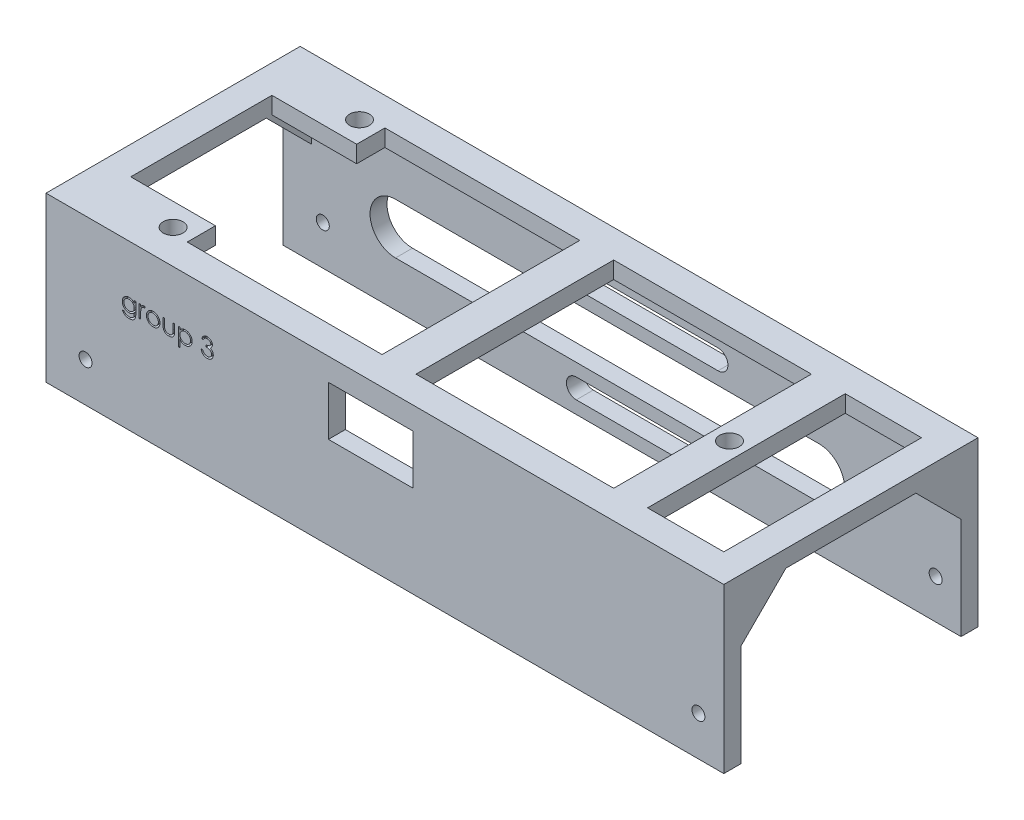
from build123d import *

# Parameters (mm, degrees)
SKETCH1_W           = 120
SKETCH1_H           = 29
BOSS_EXTRUDE5_DEPTH = 45
SHELL9_T            = -3
SKETCH3_R           = 1.15
CUT_EXTRUDE2_DEPTH  = 79
CUT_EXTRUDE8_DEPTH  = 23
SKETCH7_W           = 15
SKETCH7_H           = 8.75
CUT_EXTRUDE9_DEPTH  = 20
SKETCH13_W          = 110
SKETCH13_H          = 35
CUT_EXTRUDE14_DEPTH = 10
SKETCH17_W          = 15
SKETCH17_H          = 5
SKETCH17_W_2        = 6
SKETCH17_H_2        = 35
BOSS_EXTRUDE6_DEPTH = 3
SKETCH17_4_R        = 1.75
CUT_EXTRUDE16_DEPTH = 10
CUT_EXTRUDE15_DEPTH = 1.5
BOSS_EXTRUDE7_DEPTH = 5
BOSS_EXTRUDE8_DEPTH = 5


with BuildPart() as part:
    # Sketch1 → Boss-Extrude5 (new body)
    with BuildSketch(Plane.XY):
        with Locations((60, 14.5)):
            Rectangle(SKETCH1_W, SKETCH1_H)
    extrude(amount=BOSS_EXTRUDE5_DEPTH)

    # Shell9
    shell9_openings = [part.faces().sort_by_distance(p)[0] for p in [
        (120, 14.5, 22.5),
        (60, 0, 22.5),
        (0, 14.5, 22.5),
    ]]
    offset(amount=SHELL9_T, openings=shell9_openings, kind=Kind.INTERSECTION)

    # Sketch3 → Cut-Extrude2 (cut)
    with BuildSketch(Plane(origin=(0, 0, 0), x_dir=(-1, 0, 0), z_dir=(0, 0, -1))):
        with Locations((-7, 7)):
            Circle(SKETCH3_R)
        with Locations((-115.5, 7)):
            Circle(SKETCH3_R)
    extrude(amount=-CUT_EXTRUDE2_DEPTH, mode=Mode.SUBTRACT)

    # Sketch6 → Cut-Extrude8 (cut)
    with BuildSketch(Plane(origin=(0, 0, 0), x_dir=(-1, 0, 0), z_dir=(0, 0, -1))):
        with BuildLine():
            Line((-51.883496676, 22.75), (-76.973496676, 22.75))
            ThreePointArc((-76.973496676, 22.75), (-78.723496676, 21), (-76.973496676, 19.25))
            Line((-76.973496676, 19.25), (-51.883496676, 19.25))
            ThreePointArc((-51.883496676, 19.25), (-50.133496676, 21), (-51.883496676, 22.75))
        make_face()
        with BuildLine():
            Line((-19.873496676, 17), (-94.873496676, 17))
            ThreePointArc((-94.873496676, 17), (-99.373496676, 12.5), (-94.873496676, 8))
            Line((-94.873496676, 8), (-19.873496676, 8))
            ThreePointArc((-19.873496676, 8), (-15.373496676, 12.5), (-19.873496676, 17))
        make_face()
        with BuildLine():
            ThreePointArc((-76.973496676, 5.75), (-78.723496676, 4), (-76.973496676, 2.25))
            Line((-76.973496676, 2.25), (-51.883496676, 2.25))
            ThreePointArc((-51.883496676, 2.25), (-50.133496676, 4), (-51.883496676, 5.75))
            Line((-51.883496676, 5.75), (-76.973496676, 5.75))
        make_face()
    extrude(amount=-CUT_EXTRUDE8_DEPTH, mode=Mode.SUBTRACT)

    # Sketch7 → Cut-Extrude9 (cut)
    with BuildSketch(Plane.XY.offset(45)):
        with Locations((57.5, 20.625)):
            Rectangle(SKETCH7_W, SKETCH7_H)
    extrude(amount=-CUT_EXTRUDE9_DEPTH, mode=Mode.SUBTRACT)

    # Sketch13 → Cut-Extrude14 (cut)
    with BuildSketch(Plane(origin=(0, 29, 0), x_dir=(1, 0, 0), z_dir=(0, 1, 0))):
        with Locations((60, -22.5)):
            Rectangle(SKETCH13_W, SKETCH13_H)
    extrude(amount=-CUT_EXTRUDE14_DEPTH, mode=Mode.SUBTRACT)

    # Sketch17 → Boss-Extrude6 (add)
    with BuildSketch(Plane(origin=(0, 29, 0), x_dir=(1, 0, 0), z_dir=(0, 1, 0))):
        with Locations((12.5, -7.5)):
            Rectangle(SKETCH17_W, SKETCH17_H)
        with Locations((12.5, -37.5)):
            Rectangle(SKETCH17_W, SKETCH17_H)
        with Locations((57.5, -22.5)):
            Rectangle(SKETCH17_W_2, SKETCH17_H_2)
        with Locations((98.5, -22.5)):
            Rectangle(SKETCH17_W_2, SKETCH17_H_2)
    extrude(amount=-BOSS_EXTRUDE6_DEPTH)

    # Sketch17<4> → Cut-Extrude16 (cut)
    with BuildSketch(Plane(origin=(0, 29, 0), x_dir=(1, 0, 0), z_dir=(0, 1, 0))):
        with Locations((98.5, -22.5)):
            Circle(SKETCH17_4_R)
        with Locations((16.5, -6)):
            Circle(SKETCH17_4_R)
        with Locations((16.5, -39)):
            Circle(SKETCH17_4_R)
    extrude(amount=-CUT_EXTRUDE16_DEPTH, mode=Mode.SUBTRACT)

    # Sketch20 → Cut-Extrude15 (cut)
    # profile 1 of 6: a face of its own
    with BuildSketch(Plane.XY.offset(45)):
        with BuildLine():
            Line((15.616704574, 20.332761713), (15.901640472, 20.332761713))
            Line((15.901640472, 20.332761713), (15.901640472, 18.49149068))
            add(Edge.make_bspline(
                [(15.901640472, 18.49149068), (15.901389155, 18.452268005), (15.900904052, 18.376558794), (15.897410671, 18.267086354), (15.890044057, 18.165970691), (15.881690467, 18.072750642), (15.869673803, 17.9878583), (15.854999527, 17.91104035), (15.838457161, 17.842223075), (15.823924535, 17.799836969), (15.817050127, 17.779786954)],
                knots=[0, 0, 0, 0, 1.307562039, 2.523909702, 3.650326591, 4.686913197, 5.643429486, 6.506965704, 7.293745905, 8, 8, 8, 8], degree=3))
            add(Edge.make_bspline(
                [(15.817050127, 17.779786954), (15.806899889, 17.753724811), (15.786902899, 17.702379766), (15.749450931, 17.629595775), (15.707510176, 17.561064407), (15.659606909, 17.497167576), (15.605957751, 17.438226048), (15.547826683, 17.382959277), (15.484081581, 17.332536497), (15.414758892, 17.287827692), (15.341456639, 17.247562292), (15.264216961, 17.212685764), (15.183475406, 17.182308413), (15.098473497, 17.159554734), (15.010543928, 17.139838237), (14.918652687, 17.127006986), (14.823336649, 17.118273869), (14.758525483, 17.117466301), (14.725643877, 17.117056585)],
                knots=[0, 0, 0, 0, 0.981931301, 1.934503488, 2.87077864, 3.801706999, 4.735015492, 5.667491629, 6.616593066, 7.585388521, 8.561939025, 9.551802639, 10.560317337, 11.588439944, 12.640189604, 13.723962949, 14.845264515, 16, 16, 16, 16], degree=3))
            add(Edge.make_bspline(
                [(14.725643877, 17.117056585), (14.677669868, 17.11783354), (14.583963739, 17.119351142), (14.447343495, 17.137032186), (14.317590571, 17.162027939), (14.196419457, 17.19986072), (14.084595869, 17.246158561), (13.982883496, 17.299312554), (13.89219542, 17.360262855), (13.810440374, 17.429659829), (13.736651931, 17.512176883), (13.667230747, 17.609421549), (13.600409749, 17.722875084), (13.561249628, 17.806144188), (13.540743036, 17.849748893)],
                knots=[0, 0, 0, 0, 1.157897085, 2.2616841, 3.32207898, 4.345638746, 5.321241055, 6.241986252, 7.112515963, 7.955008012, 8.825025602, 9.77857164, 10.836726669, 12, 12, 12, 12], degree=3))
            Line((13.540743036, 17.849748893), (13.825678933, 17.849748893))
            add(Edge.make_bspline(
                [(13.825678933, 17.849748893), (13.848595366, 17.813367134), (13.89339417, 17.742245276), (13.977167435, 17.650158342), (14.068976031, 17.571460647), (14.171918315, 17.508041587), (14.286422618, 17.460226276), (14.412557826, 17.426140115), (14.55135034, 17.405732787), (14.647977577, 17.403273256), (14.698295119, 17.401992483)],
                knots=[0, 0, 0, 0, 0.997731894, 1.950442991, 2.880492273, 3.800895997, 4.748200782, 5.754801363, 6.83083817, 8, 8, 8, 8], degree=3))
            add(Edge.make_bspline(
                [(14.698295119, 17.401992483), (14.747976513, 17.403289832), (14.843757266, 17.405790991), (14.981489827, 17.426149222), (15.107215235, 17.460233694), (15.220209131, 17.507957016), (15.319138293, 17.566422742), (15.404420599, 17.631737095), (15.473494698, 17.705379862), (15.519952175, 17.773217644), (15.548830721, 17.833655247), (15.567220536, 17.885682245), (15.582164779, 17.944513069), (15.594665061, 18.009950487), (15.604980103, 18.08208799), (15.611514147, 18.161090521), (15.616236561, 18.246778529), (15.616544963, 18.306190162), (15.616704574, 18.336938396)],
                knots=[0, 0, 0, 0, 1.570740765, 3.028230971, 4.391408896, 5.680370741, 6.894727393, 8.017376726, 9.065722033, 10.075533815, 10.603371122, 11.180248986, 11.817768598, 12.521299649, 13.286540596, 14.121245857, 15.027658897, 16, 16, 16, 16], degree=3))
            Line((15.616704574, 18.336938396), (15.616704574, 18.457145728))
            add(Edge.make_bspline(
                [(15.616704574, 18.457145728), (15.587783846, 18.422727093), (15.530451097, 18.354495237), (15.431438879, 18.265085752), (15.323292106, 18.188081905), (15.206194892, 18.124927858), (15.083015558, 18.074416852), (14.955088249, 18.039090023), (14.823559742, 18.016266399), (14.734431006, 18.013810477), (14.689390872, 18.012569406)],
                knots=[0, 0, 0, 0, 1.012485704, 2.007162095, 2.997754123, 3.998611389, 4.999708251, 5.992315798, 6.98544096, 8, 8, 8, 8], degree=3))
            add(Edge.make_bspline(
                [(14.689390872, 18.012569406), (14.662869399, 18.013036608), (14.610140308, 18.013965485), (14.531804216, 18.022092376), (14.454624104, 18.033884092), (14.378779973, 18.051193683), (14.304162381, 18.073411178), (14.230894637, 18.101184934), (14.158383509, 18.132585791), (14.087947043, 18.169572548), (14.020286767, 18.210722641), (13.955913021, 18.255298635), (13.895162989, 18.303067225), (13.838614888, 18.354499449), (13.786342893, 18.409520868), (13.737643956, 18.467544948), (13.693323362, 18.52938192), (13.652471645, 18.593904232), (13.617040867, 18.661541641), (13.585940044, 18.730827485), (13.558898655, 18.801613615), (13.537340041, 18.874137022), (13.520874388, 18.948351984), (13.508618682, 19.02413692), (13.501667308, 19.1017252), (13.500583341, 19.153995995), (13.500037908, 19.180297771)],
                knots=[0, 0, 0, 0, 1.028754217, 2.045334182, 3.052854819, 4.056607503, 5.061168794, 6.071104265, 7.095078842, 8.125279047, 9.155117945, 10.165957491, 11.161587969, 12.151493252, 13.128948131, 14.104219989, 15.088194871, 16.07871515, 17.064853787, 18.047899887, 19.02414258, 20.002704429, 20.980574569, 21.971845993, 22.979467364, 24, 24, 24, 24], degree=3))
            add(Edge.make_bspline(
                [(13.500037908, 19.180297771), (13.500508866, 19.206607723), (13.501448958, 19.259125723), (13.509568775, 19.337030594), (13.521151346, 19.413892296), (13.53948268, 19.488918582), (13.561546682, 19.562963892), (13.588873066, 19.635481306), (13.621728655, 19.706492911), (13.658930356, 19.776051293), (13.700735212, 19.843223058), (13.746575391, 19.907019373), (13.796506234, 19.966970786), (13.8498389, 20.023682111), (13.907224591, 20.07660618), (13.96863362, 20.125614541), (14.033460661, 20.171528693), (14.101906631, 20.213358264), (14.172915405, 20.250353587), (14.24468294, 20.284110729), (14.31815991, 20.310902394), (14.391976428, 20.334509063), (14.467432493, 20.351232418), (14.543602915, 20.364134024), (14.620748464, 20.371994163), (14.672412876, 20.372975315), (14.698295119, 20.373466842)],
                knots=[0, 0, 0, 0, 1.008818848, 2.013730394, 3.001654427, 3.987803273, 4.973046549, 5.963777569, 6.957074694, 7.972068341, 8.987420212, 9.989399531, 10.982630087, 11.977756091, 12.973280677, 13.973972381, 14.989194003, 16.018387222, 17.047741039, 18.059210846, 19.057554164, 20.045176975, 21.029480261, 22.018708529, 23.007435371, 24, 24, 24, 24], degree=3))
            add(Edge.make_bspline(
                [(14.698295119, 20.373466842), (14.740977042, 20.372236145), (14.825260726, 20.369805898), (14.949295278, 20.350736716), (15.068985739, 20.320334718), (15.18500751, 20.276777682), (15.298305708, 20.217314433), (15.408506924, 20.138989044), (15.515929996, 20.04109895), (15.582222028, 19.966030281), (15.616704574, 19.926982467)],
                knots=[0, 0, 0, 0, 0.96728863, 1.910097829, 2.838038873, 3.762875196, 4.71315279, 5.730631239, 6.819562287, 8, 8, 8, 8], degree=3))
            Line((15.616704574, 19.926982467), (15.616704574, 20.332761713))
        make_face()
        with BuildLine():
            add(Edge.make_bspline(
                [(14.721191754, 20.088530944), (14.679526044, 20.087114835), (14.597036773, 20.084311238), (14.476125205, 20.060376534), (14.359396844, 20.022869897), (14.249083349, 19.969219095), (14.145753328, 19.903819322), (14.054064026, 19.824589204), (13.973868138, 19.734105154), (13.90602933, 19.633185287), (13.852025876, 19.524307938), (13.813795774, 19.409544629), (13.78907611, 19.290749742), (13.78634774, 19.209676024), (13.784973805, 19.168849454)],
                knots=[0, 0, 0, 0, 1.026226791, 2.031711442, 3.026614839, 4.04107745, 5.047145931, 6.032893242, 7.017642609, 8.019221815, 9.021877557, 10.003543541, 10.994637589, 12, 12, 12, 12], degree=3))
            add(Edge.make_bspline(
                [(13.784973805, 19.168849454), (13.78563217, 19.138067128), (13.786926982, 19.077527295), (13.799376227, 18.988683633), (13.819497532, 18.904065063), (13.848015569, 18.823666466), (13.883351228, 18.747026688), (13.927794307, 18.674673668), (13.980091974, 18.60654297), (14.039834895, 18.543138509), (14.105672041, 18.485388916), (14.177081601, 18.434645122), (14.25396672, 18.393142682), (14.334436469, 18.357273494), (14.42044337, 18.331076054), (14.510748612, 18.311083733), (14.605991079, 18.299645788), (14.670916871, 18.298228108), (14.704019278, 18.297505303)],
                knots=[0, 0, 0, 0, 1.039728707, 2.044842319, 3.024901384, 3.974314358, 4.923051295, 5.871625912, 6.837440708, 7.820715446, 8.810779094, 9.792721783, 10.773906224, 11.758876063, 12.764959493, 13.806266761, 14.881525401, 16, 16, 16, 16], degree=3))
            add(Edge.make_bspline(
                [(14.704019278, 18.297505303), (14.737550687, 18.298201634), (14.803121003, 18.299563302), (14.898888923, 18.311268619), (14.989632909, 18.330157126), (15.075269755, 18.356975013), (15.1561228, 18.39119403), (15.231283772, 18.434497961), (15.302364264, 18.483814268), (15.367094722, 18.541338023), (15.425627358, 18.604733697), (15.476636696, 18.673717281), (15.520101946, 18.747250752), (15.556095261, 18.825325821), (15.583573711, 18.908549241), (15.60200586, 18.996712964), (15.614893407, 19.089394606), (15.616091675, 19.152902422), (15.616704574, 19.185385912)],
                knots=[0, 0, 0, 0, 1.121943988, 2.193949579, 3.223793937, 4.220241907, 5.192961521, 6.155822191, 7.11847367, 8.083710714, 9.04790392, 10.001595906, 10.949595423, 11.902125208, 12.873731292, 13.87582262, 14.913508608, 16, 16, 16, 16], degree=3))
            add(Edge.make_bspline(
                [(15.616704574, 19.185385912), (15.615489395, 19.227674965), (15.613115361, 19.310292915), (15.59071151, 19.430676912), (15.554588891, 19.543859923), (15.503927909, 19.649483987), (15.440444229, 19.746429935), (15.363980388, 19.83290228), (15.27585506, 19.909012343), (15.176321441, 19.97241999), (15.069235544, 20.023642205), (14.957184173, 20.062070384), (14.840333683, 20.083836656), (14.761134297, 20.086957176), (14.721191754, 20.088530944)],
                knots=[0, 0, 0, 0, 1.070913519, 2.092188694, 3.091357305, 4.074328408, 5.051968682, 6.018948707, 6.99050112, 7.9935919, 9.000589572, 9.992915277, 10.987769056, 12, 12, 12, 12], degree=3))
        make_face(mode=Mode.SUBTRACT)
    # profile 2 of 6: a face of its own
    with BuildSketch(Plane.XY.offset(45)):
        with BuildLine():
            Line((16.471512267, 20.332761713), (16.756448164, 20.332761713))
            Line((16.756448164, 20.332761713), (16.756448164, 19.991220247))
            add(Edge.make_bspline(
                [(16.756448164, 19.991220247), (16.777483681, 20.023020891), (16.817713944, 20.083839376), (16.884582101, 20.1642751), (16.953074409, 20.230873035), (17.023518757, 20.283944084), (17.096433176, 20.323688842), (17.170217411, 20.352801809), (17.246032302, 20.370016945), (17.29697919, 20.372315336), (17.322503853, 20.373466842)],
                knots=[0, 0, 0, 0, 1.2804753, 2.448899062, 3.506932113, 4.484331642, 5.4025378, 6.288909075, 7.142734305, 8, 8, 8, 8], degree=3))
            add(Edge.make_bspline(
                [(17.322503853, 20.373466842), (17.342303449, 20.372386864), (17.383042405, 20.37016474), (17.444712326, 20.354552063), (17.508251743, 20.329625571), (17.549202337, 20.306184798), (17.570550728, 20.293964638)],
                knots=[0, 0, 0, 0, 0.901110191, 1.854092781, 2.881294221, 4, 4, 4, 4], degree=3))
            Line((17.570550728, 20.293964638), (17.414090392, 20.047189798))
            add(Edge.make_bspline(
                [(17.414090392, 20.047189798), (17.400384351, 20.053304183), (17.374367662, 20.064910455), (17.336308877, 20.078646421), (17.301219379, 20.08673443), (17.278864151, 20.087959724), (17.268442355, 20.088530944)],
                knots=[0, 0, 0, 0, 1.180555205, 2.24091978, 3.179933427, 4, 4, 4, 4], degree=3))
            add(Edge.make_bspline(
                [(17.268442355, 20.088530944), (17.245577154, 20.08700691), (17.198938771, 20.083898323), (17.130463547, 20.059460976), (17.064017868, 20.019977365), (17.01124786, 19.976188571), (16.970388102, 19.933963069), (16.941232326, 19.897089161), (16.914487262, 19.855742831), (16.888932848, 19.810630903), (16.865649853, 19.760983115), (16.843919546, 19.707295485), (16.824271863, 19.649505833), (16.813068427, 19.609244546), (16.807329574, 19.588621088)],
                knots=[0, 0, 0, 0, 1.125678352, 2.296057538, 3.5422874, 4.923748041, 5.663163013, 6.437101912, 7.23742474, 8.08941207, 8.991984279, 9.93940061, 10.944477711, 12, 12, 12, 12], degree=3))
            add(Edge.make_bspline(
                [(16.807329574, 19.588621088), (16.803036618, 19.570226795), (16.793528044, 19.529484834), (16.784282864, 19.461132958), (16.775148372, 19.380375782), (16.768710726, 19.286988515), (16.762743502, 19.18120437), (16.759377927, 19.06286219), (16.756562935, 18.931840507), (16.756487582, 18.840242344), (16.756448164, 18.792327018)],
                knots=[0, 0, 0, 0, 0.566838948, 1.255505196, 2.06880316, 3.007127437, 4.065329342, 5.249902469, 6.561414163, 8, 8, 8, 8], degree=3))
            Line((16.756448164, 18.792327018), (16.756448164, 18.012569406))
            Line((16.756448164, 18.012569406), (16.471512267, 18.012569406))
            Line((16.471512267, 18.012569406), (16.471512267, 20.332761713))
        make_face()
    # profile 3 of 6: a face of its own
    with BuildSketch(Plane.XY.offset(45)):
        with BuildLine():
            add(Edge.make_bspline(
                [(18.976149687, 20.373466842), (19.019684627, 20.37253984), (19.105046006, 20.370722218), (19.230057445, 20.351295784), (19.349387675, 20.321589247), (19.463493721, 20.280521473), (19.570914218, 20.225474275), (19.673213846, 20.159788703), (19.770112133, 20.081971636), (19.828190167, 20.021775389), (19.857670119, 19.991220247)],
                knots=[0, 0, 0, 0, 1.054011418, 2.066658804, 3.057071809, 4.030435133, 4.997543892, 5.974964718, 6.972108034, 8, 8, 8, 8], degree=3))
            add(Edge.make_bspline(
                [(19.857670119, 19.991220247), (19.883053749, 19.96199756), (19.933329765, 19.904117725), (19.997796525, 19.810268705), (20.053333226, 19.713077328), (20.09784034, 19.611252967), (20.132933183, 19.505684516), (20.157848493, 19.39600912), (20.172668427, 19.282468991), (20.174666833, 19.205358366), (20.175678933, 19.166305383)],
                knots=[0, 0, 0, 0, 1.025258237, 2.030674902, 3.01204498, 3.988269485, 4.97094183, 5.956517959, 6.965070386, 8, 8, 8, 8], degree=3))
            add(Edge.make_bspline(
                [(20.175678933, 19.166305383), (20.17478872, 19.127026045), (20.173029618, 19.049408242), (20.156389337, 18.935090674), (20.130507566, 18.824242513), (20.093467256, 18.717327841), (20.045970971, 18.614019848), (19.98801299, 18.514769757), (19.919186595, 18.41938175), (19.841168683, 18.328665797), (19.754943053, 18.245057873), (19.661401975, 18.172188657), (19.562383673, 18.109757703), (19.456571489, 18.059468955), (19.344931697, 18.019818012), (19.227223499, 17.991968712), (19.103629757, 17.975130613), (19.019240778, 17.972968371), (18.976149687, 17.971864278)],
                knots=[0, 0, 0, 0, 0.998656419, 1.973391657, 2.932242238, 3.890759089, 4.846373663, 5.82037756, 6.809684879, 7.83454468, 8.860553229, 9.859544525, 10.845671541, 11.83227036, 12.833544569, 13.85385346, 14.904124723, 16, 16, 16, 16], degree=3))
            add(Edge.make_bspline(
                [(18.976149687, 17.971864278), (18.932847477, 17.972972077), (18.848037911, 17.975141758), (18.724007913, 17.991903293), (18.606088759, 18.019805177), (18.494302816, 18.05959926), (18.388035705, 18.10975931), (18.288443668, 18.171999915), (18.194826602, 18.245079484), (18.10858273, 18.328659941), (18.03056971, 18.419383259), (17.961742052, 18.514769365), (17.903784399, 18.61401995), (17.856288029, 18.717327814), (17.819247741, 18.824242521), (17.793365964, 18.935090672), (17.776725685, 19.049408242), (17.774966583, 19.127026045), (17.774076369, 19.166305383)],
                knots=[0, 0, 0, 0, 1.099876186, 2.154163076, 3.173186993, 4.173200201, 5.163417411, 6.152872554, 7.150605724, 8.17532212, 9.198891216, 10.186952605, 11.159729845, 12.11414092, 13.071450619, 14.029093627, 15.002601286, 16, 16, 16, 16], degree=3))
            add(Edge.make_bspline(
                [(17.774076369, 19.166305383), (17.775095372, 19.205146107), (17.777112823, 19.282044065), (17.791917856, 19.395370756), (17.816735975, 19.50486053), (17.851870885, 19.610021498), (17.896788237, 19.711399643), (17.951544548, 19.808831168), (18.016668907, 19.902255816), (18.066744963, 19.960060846), (18.092085183, 19.989312194)],
                knots=[0, 0, 0, 0, 1.031353054, 2.041901799, 3.029428768, 4.008703097, 4.981709435, 5.96992636, 6.972712378, 8, 8, 8, 8], degree=3))
            add(Edge.make_bspline(
                [(18.092085183, 19.989312194), (18.121520691, 20.020132318), (18.179410796, 20.080745514), (18.276791428, 20.158335732), (18.378839394, 20.22538817), (18.487447005, 20.279341594), (18.601459312, 20.321830821), (18.721401054, 20.351372396), (18.8468367, 20.370652225), (18.932615785, 20.372519286), (18.976149687, 20.373466842)],
                knots=[0, 0, 0, 0, 1.027980169, 2.021703884, 2.998553061, 3.971491411, 4.943284454, 5.930300938, 6.949603206, 8, 8, 8, 8], degree=3))
        make_face()
        with BuildLine():
            add(Edge.make_bspline(
                [(18.974877651, 20.088530944), (18.94409139, 20.087655922), (18.883313609, 20.085928465), (18.793851557, 20.072789495), (18.707727274, 20.05197283), (18.624777366, 20.022396294), (18.545281559, 19.984206578), (18.469163744, 19.937299709), (18.396200031, 19.882296955), (18.327817731, 19.819284389), (18.26505949, 19.750451301), (18.210197326, 19.67711029), (18.163547408, 19.600450961), (18.124685264, 19.520393598), (18.095740886, 19.436126908), (18.074719644, 19.348605193), (18.061593069, 19.257650137), (18.059881854, 19.195818356), (18.059012267, 19.16439733)],
                knots=[0, 0, 0, 0, 1.021534396, 2.016698045, 2.994645724, 3.958388632, 4.93408049, 5.916473867, 6.921342795, 7.962252576, 8.998418191, 10.008913653, 10.997312074, 11.973003931, 12.956656626, 13.948281152, 14.957379055, 16, 16, 16, 16], degree=3))
            add(Edge.make_bspline(
                [(18.059012267, 19.16439733), (18.060469885, 19.123800849), (18.063362986, 19.043224424), (18.08688995, 18.924560048), (18.126247504, 18.810639368), (18.179394536, 18.702130218), (18.245984463, 18.601734651), (18.324440588, 18.512225519), (18.413920888, 18.434949819), (18.513358713, 18.370832194), (18.620722987, 18.319887273), (18.734348364, 18.283783917), (18.852858136, 18.260314596), (18.933848514, 18.257981901), (18.974877651, 18.256800175)],
                knots=[0, 0, 0, 0, 1.016792936, 2.018143844, 3.017858371, 4.030088057, 5.03801393, 6.028138512, 7.003788237, 7.991172063, 8.984598303, 9.972568034, 10.972917682, 12, 12, 12, 12], degree=3))
            add(Edge.make_bspline(
                [(18.974877651, 18.256800175), (19.015904429, 18.257988786), (19.096890148, 18.260335072), (19.215235258, 18.283665716), (19.328550076, 18.320045465), (19.435802834, 18.370774898), (19.535195396, 18.435193303), (19.625319242, 18.51178916), (19.703105482, 18.601971725), (19.769629538, 18.702263197), (19.82364694, 18.810471145), (19.862820273, 18.924581074), (19.886403798, 19.043219069), (19.889289264, 19.123799055), (19.890743036, 19.16439733)],
                knots=[0, 0, 0, 0, 1.02726834, 2.027799167, 3.010890988, 4.004497153, 4.992059811, 5.971914811, 6.958719428, 7.966827853, 8.981595046, 9.981490638, 10.983022906, 12, 12, 12, 12], degree=3))
            add(Edge.make_bspline(
                [(19.890743036, 19.16439733), (19.889873748, 19.195818544), (19.888163122, 19.257650694), (19.875032262, 19.348603063), (19.854026879, 19.436134725), (19.825024055, 19.520364757), (19.786330771, 19.600658243), (19.738781252, 19.67688521), (19.684143107, 19.750705362), (19.620627576, 19.819061879), (19.552316655, 19.882321519), (19.47932337, 19.937321037), (19.403318425, 19.984000427), (19.324053568, 20.022722945), (19.241093025, 20.051703747), (19.155089415, 20.072909691), (19.066009066, 20.085872941), (19.005449077, 20.087639276), (18.974877651, 20.088530944)],
                knots=[0, 0, 0, 0, 1.042956736, 2.052379634, 3.044323526, 4.02829302, 5.004299113, 5.996692471, 7.007513377, 8.048758398, 9.090003419, 10.095195979, 11.07790575, 12.047570684, 13.018257071, 13.989683339, 14.985167495, 16, 16, 16, 16], degree=3))
        make_face(mode=Mode.SUBTRACT)
    # profile 4 of 6: a face of its own
    with BuildSketch(Plane.XY.offset(45)):
        with BuildLine():
            Line((20.7048456, 20.332761713), (20.989781497, 20.332761713))
            Line((20.989781497, 20.332761713), (20.989781497, 19.256619887))
            add(Edge.make_bspline(
                [(20.989781497, 19.256619887), (20.989910225, 19.225030678), (20.990156476, 19.164602003), (20.991826473, 19.077647655), (20.995754486, 18.998348208), (21.000665598, 18.926657854), (21.00698125, 18.86258872), (21.014495442, 18.806364589), (21.022894153, 18.757347865), (21.031115329, 18.727826393), (21.034938749, 18.71409685)],
                knots=[0, 0, 0, 0, 1.388932606, 2.656963016, 3.823490214, 4.879454478, 5.816252168, 6.653371382, 7.373723809, 8, 8, 8, 8], degree=3))
            add(Edge.make_bspline(
                [(21.034938749, 18.71409685), (21.041072355, 18.696840388), (21.05321205, 18.662686223), (21.075231567, 18.613347625), (21.102471558, 18.567650048), (21.132280116, 18.523831353), (21.166660293, 18.483189551), (21.205177099, 18.445793272), (21.246541214, 18.410229561), (21.3080047, 18.368151928), (21.392059891, 18.323053022), (21.502416319, 18.284140387), (21.622072295, 18.260885035), (21.704771719, 18.258186961), (21.747278493, 18.256800175)],
                knots=[0, 0, 0, 0, 0.725840625, 1.436591201, 2.137033971, 2.831655856, 3.53531722, 4.242432219, 4.957935707, 5.694543706, 7.190802206, 8.724350549, 10.316345118, 12, 12, 12, 12], degree=3))
            add(Edge.make_bspline(
                [(21.747278493, 18.256800175), (21.789781318, 18.258216451), (21.872016419, 18.260956682), (21.990357713, 18.283438892), (22.098535782, 18.320999767), (22.195464859, 18.373439347), (22.2807053, 18.437612504), (22.351738594, 18.512913352), (22.410346603, 18.596959582), (22.435936578, 18.659665178), (22.448805937, 18.691200215)],
                knots=[0, 0, 0, 0, 1.157059328, 2.238695713, 3.266970494, 4.264342957, 5.228770407, 6.160125903, 7.074715775, 8, 8, 8, 8], degree=3))
            add(Edge.make_bspline(
                [(22.448805937, 18.691200215), (22.452610702, 18.703869643), (22.46102211, 18.731878654), (22.470059386, 18.779394569), (22.478200505, 18.836058889), (22.485152101, 18.902242407), (22.490109784, 18.977772166), (22.492782251, 19.062624564), (22.495801472, 19.156533227), (22.495847297, 19.222271837), (22.495871241, 19.256619887)],
                knots=[0, 0, 0, 0, 0.557542046, 1.232589297, 2.036731608, 2.971723315, 4.038036528, 5.22795436, 6.551621927, 8, 8, 8, 8], degree=3))
            Line((22.495871241, 19.256619887), (22.495871241, 20.332761713))
            Line((22.495871241, 20.332761713), (22.780807138, 20.332761713))
            Line((22.780807138, 20.332761713), (22.780807138, 19.203194406))
            add(Edge.make_bspline(
                [(22.780807138, 19.203194406), (22.780406458, 19.164815757), (22.779629084, 19.09035593), (22.774633136, 18.9821482), (22.766060988, 18.881308163), (22.753050123, 18.787782443), (22.737750547, 18.701642441), (22.7180145, 18.622777758), (22.694448527, 18.551431377), (22.667864238, 18.486351337), (22.636457258, 18.427344511), (22.60304989, 18.371341306), (22.564473847, 18.319731286), (22.523860848, 18.269945348), (22.478683632, 18.224459819), (22.42978876, 18.18223098), (22.377864429, 18.142613302), (22.321758371, 18.107151927), (22.262289657, 18.075205398), (22.199384872, 18.046887956), (22.132273538, 18.02447919), (22.061821525, 18.005147372), (21.98768366, 17.98998496), (21.909931418, 17.97929286), (21.828590988, 17.972738453), (21.773155978, 17.972160562), (21.744734422, 17.971864278)],
                knots=[0, 0, 0, 0, 1.493040784, 2.896703357, 4.213163133, 5.428574705, 6.569057535, 7.615249723, 8.588095153, 9.490268104, 10.346124644, 11.18633936, 12.024365274, 12.850166724, 13.684164916, 14.514361689, 15.362232829, 16.222528818, 17.093394965, 17.986930858, 18.902426812, 19.842810585, 20.827885679, 21.843828298, 22.894529745, 24, 24, 24, 24], degree=3))
            add(Edge.make_bspline(
                [(21.744734422, 17.971864278), (21.716525441, 17.97217244), (21.661092168, 17.972778009), (21.57974754, 17.979256649), (21.501779875, 17.989968347), (21.427466371, 18.005258437), (21.356732454, 18.024343879), (21.289291607, 18.047025657), (21.225933518, 18.075220094), (21.165896986, 18.106949736), (21.109651962, 18.142841093), (21.056939181, 18.1821821), (21.007829322, 18.224914029), (20.962311553, 18.270858417), (20.921024781, 18.320585209), (20.883454515, 18.373694396), (20.849022361, 18.429659748), (20.817859472, 18.489588474), (20.791088094, 18.555421654), (20.767452264, 18.628262592), (20.748120471, 18.708909875), (20.732388374, 18.797294553), (20.719732425, 18.892993627), (20.71094571, 18.996560689), (20.706032778, 19.107743467), (20.705249858, 19.18453301), (20.7048456, 19.224182988)],
                knots=[0, 0, 0, 0, 1.083640291, 2.129454052, 3.13281866, 4.105697902, 5.042300162, 5.946461698, 6.836384745, 7.703652036, 8.553297018, 9.397182691, 10.228592656, 11.052265423, 11.879314572, 12.708807002, 13.549817954, 14.402308542, 15.300838682, 16.27712199, 17.341985831, 18.484375296, 19.725102775, 21.0496083, 22.476576903, 24, 24, 24, 24], degree=3))
            Line((20.7048456, 19.224182988), (20.7048456, 20.332761713))
        make_face()
    # profile 5 of 6: a face of its own
    with BuildSketch(Plane.XY.offset(45)):
        with BuildLine():
            Line((23.43208919, 20.332761713), (23.717025087, 20.332761713))
            Line((23.717025087, 20.332761713), (23.717025087, 19.903449814))
            add(Edge.make_bspline(
                [(23.717025087, 19.903449814), (23.747285091, 19.942400473), (23.806089351, 20.018093283), (23.907439801, 20.116055757), (24.014416263, 20.198674068), (24.129771645, 20.263428223), (24.251713135, 20.312251388), (24.379740309, 20.348337032), (24.51493976, 20.369601798), (24.607374399, 20.372161448), (24.654515071, 20.373466842)],
                knots=[0, 0, 0, 0, 1.0828784, 2.104357462, 3.088488658, 4.04616522, 5.001424249, 5.969181776, 6.964304535, 8, 8, 8, 8], degree=3))
            add(Edge.make_bspline(
                [(24.654515071, 20.373466842), (24.69569174, 20.372275601), (24.777079588, 20.369921051), (24.896879803, 20.35397978), (25.012246044, 20.32665873), (25.122525636, 20.2872879), (25.228899988, 20.238614724), (25.329794321, 20.177185698), (25.42678019, 20.106060082), (25.517418447, 20.024206631), (25.601167116, 19.935643847), (25.673599009, 19.840373614), (25.736075665, 19.741528982), (25.786576577, 19.637577584), (25.826135578, 19.529337997), (25.854270321, 19.416372911), (25.87101404, 19.299101165), (25.873260536, 19.21936084), (25.874396882, 19.179025736)],
                knots=[0, 0, 0, 0, 1.041296284, 2.058176809, 3.050446431, 4.034000596, 5.01514041, 6.003636468, 7.015969324, 8.052561599, 9.08815499, 10.094063707, 11.074456064, 12.040834395, 13.011057502, 13.983766392, 14.980127149, 16, 16, 16, 16], degree=3))
            add(Edge.make_bspline(
                [(25.874396882, 19.179025736), (25.873285192, 19.137839356), (25.871092778, 19.056613871), (25.854088379, 18.93733629), (25.826913215, 18.822594172), (25.787853292, 18.712578369), (25.737378513, 18.607364628), (25.675960805, 18.507028826), (25.603492367, 18.41160311), (25.520669201, 18.322382979), (25.430814037, 18.240196459), (25.334768029, 18.16831621), (25.234021718, 18.107953677), (25.129090538, 18.057531992), (25.019076209, 18.019529797), (24.904492021, 17.992117935), (24.785400359, 17.975213785), (24.704391457, 17.972989342), (24.663419318, 17.971864278)],
                knots=[0, 0, 0, 0, 1.038740735, 2.04854663, 3.033179607, 4.009277356, 4.987731542, 5.972001279, 6.972200261, 8.005528982, 9.039189865, 10.040446548, 11.026516639, 11.997840187, 12.972163198, 13.956796175, 14.96660207, 16, 16, 16, 16], degree=3))
            add(Edge.make_bspline(
                [(24.663419318, 17.971864278), (24.617311449, 17.973038853), (24.52623489, 17.975358984), (24.393068432, 17.998871592), (24.264910145, 18.034011526), (24.143179897, 18.085445614), (24.026913381, 18.150991689), (23.916768272, 18.230920233), (23.812159503, 18.325064085), (23.749195845, 18.39648509), (23.717025087, 18.432977058)],
                knots=[0, 0, 0, 0, 1.014726462, 2.004382257, 2.969841629, 3.936926163, 4.907207904, 5.903978561, 6.929055279, 8, 8, 8, 8], degree=3))
            Line((23.717025087, 18.432977058), (23.717025087, 17.157761713))
            Line((23.717025087, 17.157761713), (23.43208919, 17.157761713))
            Line((23.43208919, 17.157761713), (23.43208919, 20.332761713))
        make_face()
        with BuildLine():
            add(Edge.make_bspline(
                [(24.651971001, 20.088530944), (24.619695255, 20.087950139), (24.55615263, 20.086806682), (24.46301426, 20.073223171), (24.373301979, 20.053503935), (24.287919923, 20.023648139), (24.206049721, 19.987000645), (24.128321943, 19.941206249), (24.05479115, 19.887093358), (23.985642343, 19.825698524), (23.923173499, 19.758048629), (23.867871414, 19.685851116), (23.821419073, 19.609197418), (23.782863669, 19.528801553), (23.753523691, 19.44403333), (23.732699574, 19.355375526), (23.719609182, 19.262731101), (23.717895646, 19.199633867), (23.717025087, 19.167577419)],
                knots=[0, 0, 0, 0, 1.05670511, 2.080379991, 3.077984906, 4.06214886, 5.038337365, 6.01289324, 7.01187578, 8.025460281, 9.038092164, 10.024533457, 11.000252242, 11.969694649, 12.940728589, 13.933144304, 14.949937299, 16, 16, 16, 16], degree=3))
            add(Edge.make_bspline(
                [(23.717025087, 19.167577419), (23.718468221, 19.125496774), (23.721295442, 19.043057226), (23.744280055, 18.922603059), (23.78168633, 18.808619057), (23.834780234, 18.702065116), (23.901861248, 18.604109258), (23.982686004, 18.516397065), (24.076523176, 18.439479886), (24.181812699, 18.374690606), (24.294681347, 18.322087146), (24.41241571, 18.284427827), (24.533396709, 18.261230162), (24.615192256, 18.258284834), (24.656423124, 18.256800175)],
                knots=[0, 0, 0, 0, 1.03728447, 2.032128127, 3.01272805, 3.987917167, 4.958271349, 5.931593992, 6.91984656, 7.941419022, 8.973179163, 9.983609215, 10.983593296, 12, 12, 12, 12], degree=3))
            add(Edge.make_bspline(
                [(24.656423124, 18.256800175), (24.696823428, 18.258212031), (24.777010768, 18.261014312), (24.895082778, 18.285269668), (25.009827857, 18.32232194), (25.118848442, 18.376350966), (25.221195463, 18.442563376), (25.313616587, 18.521992835), (25.394358573, 18.614058712), (25.463178381, 18.716573568), (25.518633371, 18.826496952), (25.56029866, 18.940235783), (25.584345723, 19.057389131), (25.587753667, 19.136308485), (25.589460985, 19.175845648)],
                knots=[0, 0, 0, 0, 1.00104056, 1.986885549, 2.97790532, 3.984399681, 4.995088187, 5.994304198, 6.996462723, 8.023150851, 9.048424203, 10.043036403, 11.019596776, 12, 12, 12, 12], degree=3))
            add(Edge.make_bspline(
                [(25.589460985, 19.175845648), (25.588141333, 19.215628388), (25.585512312, 19.294883921), (25.55961607, 19.411690268), (25.520699662, 19.525888647), (25.463949665, 19.63431086), (25.396638513, 19.736613063), (25.315225166, 19.826922653), (25.223951902, 19.905998906), (25.121726732, 19.971327171), (25.012016489, 20.023293299), (24.896523672, 20.061287742), (24.775834119, 20.08412393), (24.693621889, 20.087049017), (24.651971001, 20.088530944)],
                knots=[0, 0, 0, 0, 0.983928682, 1.960191568, 2.949917689, 3.96440592, 4.982380491, 5.975291189, 6.965713506, 7.964880129, 8.970154049, 9.96478489, 10.968906225, 12, 12, 12, 12], degree=3))
        make_face(mode=Mode.SUBTRACT)
    # profile 6 of 6: a face of its own
    with BuildSketch(Plane.XY.offset(45)):
        with BuildLine():
            Line((27.868948164, 20.454877098), (27.584012267, 20.454877098))
            add(Edge.make_bspline(
                [(27.584012267, 20.454877098), (27.591731645, 20.486837994), (27.606822398, 20.549318932), (27.638298054, 20.638588376), (27.672587378, 20.723064713), (27.71376178, 20.801166151), (27.758673293, 20.874462299), (27.810128904, 20.941290719), (27.865754653, 21.003351052), (27.927281571, 21.058426632), (27.991805428, 21.108299286), (28.060235405, 21.150821659), (28.131194744, 21.187401427), (28.205175086, 21.217536923), (28.282396685, 21.240238648), (28.362161414, 21.256709464), (28.444678304, 21.267405689), (28.50069219, 21.268449596), (28.529134462, 21.268979662)],
                knots=[0, 0, 0, 0, 1.162005537, 2.271625781, 3.343758855, 4.383309926, 5.390229558, 6.379919256, 7.361854164, 8.333198761, 9.295911338, 10.242430842, 11.177959212, 12.116337295, 13.062827104, 14.020064771, 14.994644689, 16, 16, 16, 16], degree=3))
            add(Edge.make_bspline(
                [(28.529134462, 21.268979662), (28.570575235, 21.267728503), (28.652552838, 21.265253477), (28.772987888, 21.242652524), (28.889126502, 21.206888297), (28.999697463, 21.157472844), (29.102402755, 21.096524353), (29.193784868, 21.023984913), (29.27260516, 20.941254118), (29.338730774, 20.849875292), (29.390505951, 20.752216366), (29.428684304, 20.651704794), (29.451926829, 20.548579006), (29.454939049, 20.478949189), (29.456448164, 20.444064798)],
                knots=[0, 0, 0, 0, 1.083050992, 2.142477498, 3.193116406, 4.255571735, 5.30263384, 6.308962982, 7.297363603, 8.282367274, 9.249857812, 10.179914175, 11.08814088, 12, 12, 12, 12], degree=3))
            add(Edge.make_bspline(
                [(29.456448164, 20.444064798), (29.455392621, 20.410494349), (29.453327086, 20.344802189), (29.435788653, 20.248897688), (29.406273615, 20.158508522), (29.365388902, 20.073254182), (29.312464781, 19.99367522), (29.248354549, 19.919592591), (29.172605706, 19.850677711), (29.115202669, 19.811199332), (29.085649887, 19.790874694)],
                knots=[0, 0, 0, 0, 1.024540389, 2.004866551, 2.965041327, 3.920577974, 4.882998113, 5.874504559, 6.905732034, 8, 8, 8, 8], degree=3))
            add(Edge.make_bspline(
                [(29.085649887, 19.790874694), (29.119424407, 19.774565924), (29.1863415, 19.742253534), (29.277555195, 19.678884383), (29.360357267, 19.605717553), (29.406534213, 19.548619575), (29.429735424, 19.519931185)],
                knots=[0, 0, 0, 0, 1.015518401, 2.012035669, 3.001164323, 4, 4, 4, 4], degree=3))
            add(Edge.make_bspline(
                [(29.429735424, 19.519931185), (29.445012927, 19.49901451), (29.475317754, 19.457523686), (29.512724274, 19.390815642), (29.546659685, 19.32336822), (29.573103098, 19.253373616), (29.59358082, 19.181643096), (29.608218507, 19.108053494), (29.617311835, 19.032544717), (29.618614085, 18.981461252), (29.619268677, 18.955783548)],
                knots=[0, 0, 0, 0, 1.025084078, 2.033381695, 3.024893161, 4.013698104, 4.991890475, 5.976764909, 6.982997093, 8, 8, 8, 8], degree=3))
            add(Edge.make_bspline(
                [(29.619268677, 18.955783548), (29.617640797, 18.91132473), (29.614392697, 18.822616317), (29.58536043, 18.691557105), (29.540354133, 18.563445399), (29.476439627, 18.440913224), (29.39854553, 18.326268164), (29.305874243, 18.223691798), (29.199478715, 18.135518778), (29.080819305, 18.0618495), (28.952261624, 18.00295967), (28.814760909, 17.962086133), (28.67029836, 17.935465119), (28.57123174, 17.932610459), (28.520866233, 17.931159149)],
                knots=[0, 0, 0, 0, 0.955779014, 1.907060117, 2.875433937, 3.871313158, 4.872415639, 5.851225146, 6.836215519, 7.83643374, 8.849228613, 9.86973379, 10.916971861, 12, 12, 12, 12], degree=3))
            add(Edge.make_bspline(
                [(28.520866233, 17.931159149), (28.486921582, 17.931946743), (28.420129828, 17.933496464), (28.321937512, 17.944090624), (28.22820997, 17.963439986), (28.138820478, 17.989477984), (28.053689623, 18.022490493), (27.973077185, 18.063601026), (27.89648721, 18.111962174), (27.824642448, 18.168144786), (27.757551461, 18.230992859), (27.696997204, 18.301622104), (27.641970106, 18.378726891), (27.59394357, 18.463202807), (27.550730048, 18.553958147), (27.515187323, 18.652154999), (27.483903986, 18.756915505), (27.469359344, 18.829920312), (27.461896882, 18.867377098)],
                knots=[0, 0, 0, 0, 1.048658725, 2.063410685, 3.046034179, 4.001477787, 4.936774919, 5.862367409, 6.792675028, 7.730719943, 8.675894397, 9.627829632, 10.600096036, 11.597688215, 12.626045268, 13.701542398, 14.82072376, 16, 16, 16, 16], degree=3))
            Line((27.461896882, 18.867377098), (27.74683278, 18.867377098))
            add(Edge.make_bspline(
                [(27.74683278, 18.867377098), (27.754256194, 18.842930493), (27.76869538, 18.795379723), (27.793273779, 18.726944589), (27.821275711, 18.664208355), (27.851315346, 18.606710808), (27.882864365, 18.5538857), (27.918165762, 18.507129862), (27.954604915, 18.464389643), (27.982072614, 18.440309888), (27.995515672, 18.428524935)],
                knots=[0, 0, 0, 0, 1.198163088, 2.33053128, 3.407730985, 4.417276592, 5.372219308, 6.28897303, 7.162600585, 8, 8, 8, 8], degree=3))
            add(Edge.make_bspline(
                [(27.995515672, 18.428524935), (28.013292567, 18.414819517), (28.048791482, 18.387450989), (28.106638378, 18.352524511), (28.16747581, 18.322261295), (28.232621979, 18.299143943), (28.300671092, 18.279569922), (28.372723059, 18.266760594), (28.448142206, 18.257972039), (28.499638677, 18.257196494), (28.525954374, 18.256800175)],
                knots=[0, 0, 0, 0, 0.946170439, 1.889420265, 2.845303464, 3.807233317, 4.801018734, 5.828864929, 6.890507805, 8, 8, 8, 8], degree=3))
            add(Edge.make_bspline(
                [(28.525954374, 18.256800175), (28.55566648, 18.257358889), (28.613765938, 18.258451406), (28.698542846, 18.268498654), (28.779194602, 18.283131244), (28.854825757, 18.305730878), (28.926427002, 18.333653508), (28.992994642, 18.368713133), (29.055402538, 18.409847273), (29.112851356, 18.456600653), (29.164509066, 18.507783009), (29.209992768, 18.561316295), (29.248659425, 18.616974797), (29.279850242, 18.675066521), (29.30447967, 18.735350908), (29.321246573, 18.797997131), (29.332904733, 18.862492508), (29.33385416, 18.906333787), (29.33433278, 18.92843479)],
                knots=[0, 0, 0, 0, 1.217147791, 2.380027433, 3.494444702, 4.572153297, 5.609568379, 6.639424714, 7.649109417, 8.668170816, 9.669597737, 10.625200337, 11.543417969, 12.441394052, 13.322311151, 14.205496177, 15.095365482, 16, 16, 16, 16], degree=3))
            add(Edge.make_bspline(
                [(29.33433278, 18.92843479), (29.332944577, 18.958017934), (29.330175081, 19.017037018), (29.309030869, 19.103866532), (29.274252043, 19.187526342), (29.225563407, 19.266589094), (29.166294568, 19.339864376), (29.097020688, 19.405243507), (29.017166509, 19.459191375), (28.943669914, 19.496464656), (28.878568665, 19.521898289), (28.822856137, 19.538839149), (28.760484076, 19.553184394), (28.692206745, 19.566530526), (28.617509684, 19.577889178), (28.536474216, 19.587361396), (28.449083918, 19.594940612), (28.388585503, 19.598325249), (28.357409703, 19.600069406)],
                knots=[0, 0, 0, 0, 1.07054697, 2.135767047, 3.216561865, 4.33974944, 5.486079747, 6.621378074, 7.775625952, 8.963672916, 9.598146892, 10.304877434, 11.070270905, 11.915000392, 12.823868403, 13.805723172, 14.86925407, 16, 16, 16, 16], degree=3))
            Line((28.357409703, 19.600069406), (28.357409703, 19.925710431))
            add(Edge.make_bspline(
                [(28.357409703, 19.925710431), (28.396690046, 19.926377003), (28.473630589, 19.927682654), (28.586020422, 19.943474206), (28.693492641, 19.965318776), (28.793665471, 19.998778915), (28.884968233, 20.037641184), (28.964179586, 20.08286426), (29.030189784, 20.133133354), (29.082678042, 20.189224364), (29.122165271, 20.249381585), (29.151036723, 20.312080268), (29.168091304, 20.377869952), (29.170367931, 20.422768686), (29.171512267, 20.445336834)],
                knots=[0, 0, 0, 0, 1.321986639, 2.589447074, 3.816329219, 5.01088745, 6.139805852, 7.153945165, 8.075214402, 8.924034688, 9.728124013, 10.488707548, 11.240355623, 12, 12, 12, 12], degree=3))
            add(Edge.make_bspline(
                [(29.171512267, 20.445336834), (29.171136337, 20.46191736), (29.170388442, 20.49490353), (29.160956626, 20.543095556), (29.146783388, 20.589814271), (29.127298205, 20.634860999), (29.101217668, 20.677923319), (29.070006523, 20.719368362), (29.032842604, 20.758959505), (28.990256377, 20.795862366), (28.944525668, 20.831031602), (28.894406229, 20.860888973), (28.841409243, 20.886420565), (28.785476034, 20.907474899), (28.726425089, 20.923312968), (28.664533855, 20.934684767), (28.599684313, 20.941794639), (28.555441385, 20.942818274), (28.532950568, 20.943338637)],
                knots=[0, 0, 0, 0, 0.884392785, 1.759457502, 2.611959086, 3.489218968, 4.37281399, 5.2945488, 6.255912374, 7.266815255, 8.301784654, 9.332968512, 10.37626691, 11.440494194, 12.520033166, 13.637162961, 14.798855837, 16, 16, 16, 16], degree=3))
            add(Edge.make_bspline(
                [(28.532950568, 20.943338637), (28.496799412, 20.942076472), (28.426187796, 20.939611172), (28.324392836, 20.918018439), (28.229760297, 20.883566892), (28.157425935, 20.842443367), (28.104011029, 20.80184833), (28.065841235, 20.766395023), (28.028357629, 20.726995247), (27.994026194, 20.681222292), (27.959306229, 20.63217599), (27.927697234, 20.577363079), (27.896981656, 20.518213378), (27.878473629, 20.476398052), (27.868948164, 20.454877098)],
                knots=[0, 0, 0, 0, 1.472543308, 2.876219568, 4.221790263, 5.565193594, 6.249813518, 6.953379497, 7.687249741, 8.463570142, 9.283606569, 10.136032583, 11.040678096, 12, 12, 12, 12], degree=3))
        make_face()
    extrude(amount=-CUT_EXTRUDE15_DEPTH, mode=Mode.SUBTRACT)

    # Sketch21 → Boss-Extrude7 (add)
    with BuildSketch(Plane.ZY):
        Polygon((3, 26), (3, 18), (11, 26), align=None)
        Polygon((42, 26), (34, 26), (42, 18), align=None)
    extrude(amount=-BOSS_EXTRUDE7_DEPTH)

    # Sketch22 → Boss-Extrude8 (add)
    with BuildSketch(Plane(origin=(120, 0, 0), x_dir=(0, 0, -1), z_dir=(1, 0, 0))):
        Polygon((-42, 26), (-42, 18), (-34, 26), align=None)
        Polygon((-11, 26), (-3, 26), (-3, 18), align=None)
    extrude(amount=-BOSS_EXTRUDE8_DEPTH)


solid = part.part
